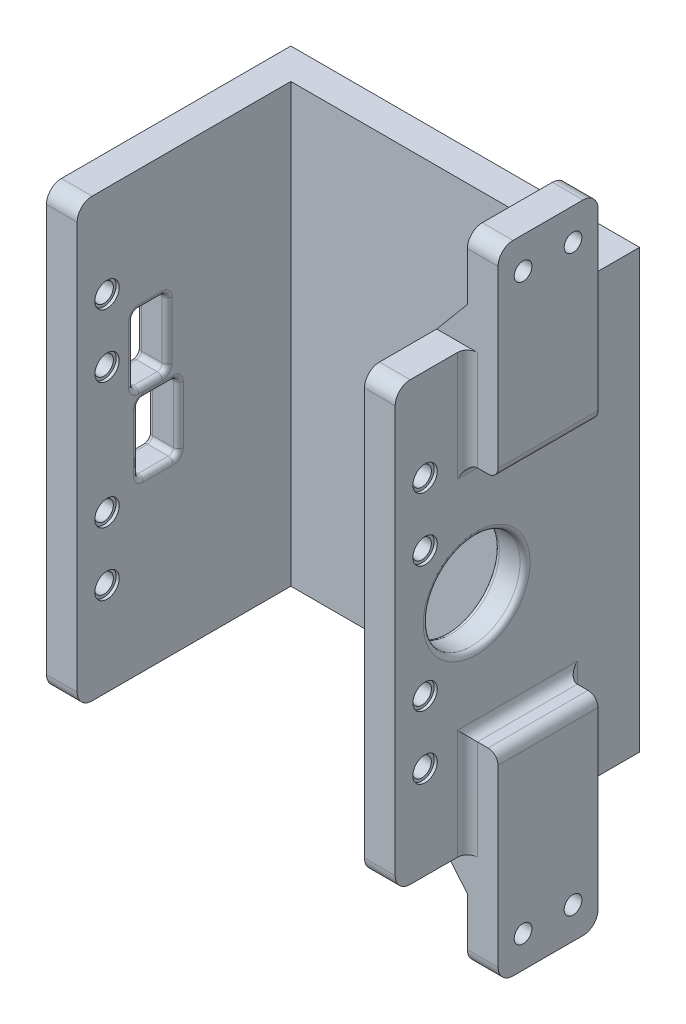
from build123d import *
from OCP.BRepFilletAPI import BRepFilletAPI_MakeChamfer

# Parameters (mm, degrees)
SKETCH1_W               = 55.1
SKETCH1_H               = 111.1
BOSS_EXTRUDE1_DEPTH     = 7.8
SKETCH2_W               = 7.8
SKETCH2_H               = 111.1
BOSS_EXTRUDE2_DEPTH     = 73.025
SKETCH4_W               = 55.1
SKETCH4_H               = 111.1
BOSS_EXTRUDE3_DEPTH     = 7.8
SKETCH7_W               = 7.8
SKETCH7_H               = 111.1
BOSS_EXTRUDE4_DEPTH     = 7
SKETCH8_R               = 2.4
CUT_EXTRUDE4_DEPTH      = 12.7
SKETCH8_4_R             = 3.1
CUT_EXTRUDE5_DEPTH      = 0.8
MIRROR2_COPY_1_SKETCH_R = 3.1
MIRROR2_COPY_1_DEPTH    = 0.8
SKETCH10_R              = 12.3
CUT_EXTRUDE7_DEPTH      = 7.8
SKETCH11_W              = 8.54
SKETCH11_H              = 17.14
SKETCH11_W_2            = 10.175
CUT_EXTRUDE8_DEPTH      = 7.8
FILLET1_R               = 1.27
SKETCH12_W              = 7.8
SKETCH12_H              = 25.4
BOSS_EXTRUDE5_DEPTH     = 25.4
CHAMFER2_SIZE           = 7.8
CHAMFER2_SIZE_2         = 9.295678022
FILLET3_R               = 3.81
FILLET4_R               = 2.54
F_8_CLEARANCE_HOLE1_D   = 4.4958


with BuildPart() as part:
    # Sketch1 → Boss-Extrude1 (new body)
    with BuildSketch(Plane(origin=(0, 0, 0), x_dir=(0, 0, -1), z_dir=(1, 0, 0))):
        with Locations((27.55, 55.55)):
            Rectangle(SKETCH1_W, SKETCH1_H)
    extrude(amount=BOSS_EXTRUDE1_DEPTH)

    # Sketch2 → Boss-Extrude2 (add)
    with BuildSketch(Plane.ZY):
        with Locations((-51.2, 55.55)):
            Rectangle(SKETCH2_W, SKETCH2_H)
    extrude(amount=BOSS_EXTRUDE2_DEPTH)

    # Sketch4 → Boss-Extrude3 (add)
    with BuildSketch(Plane.ZY.offset(73.025)):
        with Locations((-27.55, 55.55)):
            Rectangle(SKETCH4_W, SKETCH4_H)
    extrude(amount=BOSS_EXTRUDE3_DEPTH)

    # Sketch7 → Boss-Extrude4 (add)
    with BuildSketch(Plane.XY):
        with Locations((3.9, 55.55)):
            Rectangle(SKETCH7_W, SKETCH7_H)
    boss_extrude4 = extrude(amount=BOSS_EXTRUDE4_DEPTH)

    # Sketch8 → Cut-Extrude4 (cut)
    with BuildSketch(Plane(origin=(7.8, 0, 0), x_dir=(0, 0, -1), z_dir=(1, 0, 0))):
        with Locations((0.6, 23.6)):
            Circle(SKETCH8_R)
        with Locations((0.6, 39.6)):
            Circle(SKETCH8_R)
        with Locations((0.6, 87.6)):
            Circle(SKETCH8_R)
        with Locations((0.6, 71.6)):
            Circle(SKETCH8_R)
    cut_extrude4 = extrude(amount=-CUT_EXTRUDE4_DEPTH, mode=Mode.SUBTRACT)

    # Sketch8<4> → Cut-Extrude5 (cut)
    with BuildSketch(Plane(origin=(7.8, 0, 0), x_dir=(0, 0, -1), z_dir=(1, 0, 0))):
        with Locations((0.6, 23.6)):
            Circle(SKETCH8_4_R)
        with Locations((0.6, 39.6)):
            Circle(SKETCH8_4_R)
        with Locations((0.6, 87.6)):
            Circle(SKETCH8_4_R)
        with Locations((0.6, 71.6)):
            Circle(SKETCH8_4_R)
    cut_extrude5 = extrude(amount=-CUT_EXTRUDE5_DEPTH, mode=Mode.SUBTRACT)

    # Mirror1: Cut-Extrude5 across plane
    add(cut_extrude5.mirror(Plane(origin=(3.9, 0, 0), x_dir=(0, 0, 1), z_dir=(1, 0, 0))), mode=Mode.SUBTRACT)

    # Mirror2: Boss-Extrude4, Cut-Extrude4, Cut-Extrude5 across plane
    add(boss_extrude4.mirror(Plane.ZY.offset(36.5125)))
    add(cut_extrude4.mirror(Plane.ZY.offset(36.5125)), mode=Mode.SUBTRACT)
    add(cut_extrude5.mirror(Plane.ZY.offset(36.5125)), mode=Mode.SUBTRACT)

    # Mirror2 copy 1 sketch → Mirror2 copy 1 (cut)
    with BuildSketch(Plane(origin=(-73.025, 0, 0), x_dir=(0, 0, -1), z_dir=(1, 0, 0))):
        with Locations((0.6, 23.6)):
            Circle(MIRROR2_COPY_1_SKETCH_R)
        with Locations((0.6, 39.6)):
            Circle(MIRROR2_COPY_1_SKETCH_R)
        with Locations((0.6, 87.6)):
            Circle(MIRROR2_COPY_1_SKETCH_R)
        with Locations((0.6, 71.6)):
            Circle(MIRROR2_COPY_1_SKETCH_R)
    extrude(amount=-MIRROR2_COPY_1_DEPTH, mode=Mode.SUBTRACT)

    # Sketch10 → Cut-Extrude7 (cut)
    with BuildSketch(Plane(origin=(7.8, 0, 0), x_dir=(0, 0, -1), z_dir=(1, 0, 0))):
        with Locations((13.7, 55.7)):
            Circle(SKETCH10_R)
    extrude(amount=-CUT_EXTRUDE7_DEPTH, mode=Mode.SUBTRACT)

    # Sketch11 → Cut-Extrude8 (cut)
    with BuildSketch(Plane.ZY.offset(80.825)):
        with Locations((-11.6, 71.500000124)):
            Rectangle(SKETCH11_W, SKETCH11_H)
        with Locations((-13.6175, 51.5)):
            Rectangle(SKETCH11_W_2, SKETCH11_H)
    extrude(amount=-CUT_EXTRUDE8_DEPTH, mode=Mode.SUBTRACT)

    # Fillet1
    fillet1_edges = [part.edges().sort_by_distance(p)[0] for p in [
        (7.8, 55.7, -1.4),
        (0, 55.7, -1.4),
        (-73.025, 80.070000124, -11.6),
        (-73.025, 71.500000124, -7.33),
        (-80.825, 71.500000124, -15.87),
        (-80.825, 62.930000124, -11.6),
        (-73.025, 62.930000124, -11.6),
        (-76.925, 62.930000124, -7.33),
        (-76.925, 80.070000124, -7.33),
        (-80.825, 71.500000124, -7.33),
        (-76.925, 80.070000124, -15.87),
        (-80.825, 80.070000124, -11.6),
        (-73.025, 71.500000124, -15.87),
        (-76.925, 62.930000124, -15.87),
        (-73.025, 60.07, -13.6175),
        (-73.025, 51.5, -8.53),
        (-80.825, 51.5, -18.705),
        (-80.825, 42.93, -13.6175),
        (-73.025, 51.5, -18.705),
        (-76.925, 42.93, -18.705),
        (-73.025, 42.93, -13.6175),
        (-76.925, 42.93, -8.53),
        (-76.925, 60.07, -8.53),
        (-80.825, 51.5, -8.53),
        (-76.925, 60.07, -18.705),
        (-80.825, 60.07, -13.6175),
    ]]
    fillet(fillet1_edges, radius=FILLET1_R)

    # Sketch12 → Boss-Extrude5 (add, symmetric)
    with BuildSketch(Plane(origin=(0, 111.1, 0), x_dir=(1, 0, 0), z_dir=(0, 1, 0))):
        with Locations((11.7, 24.05)):
            Rectangle(SKETCH12_W, SKETCH12_H)
    boss_extrude5 = extrude(amount=BOSS_EXTRUDE5_DEPTH, both=True)

    # Mirror6: Boss-Extrude5 across plane
    add(boss_extrude5.mirror(Plane.ZX.offset(55.55)))

    # Chamfer2
    chamfer2_edges_1 = [part.edges().sort_by_distance(p)[0] for p in [
        (7.8, 111.1, -24.05),
    ]]
    chamfer2_side_1 = [part.faces().sort_by_distance(p)[0] for p in [
        (7.644, 111.1, -24.05),
    ]]
    chamfer2_edges_2 = [part.edges().sort_by_distance(p)[0] for p in [
        (7.8, 0, -24.05),
    ]]
    chamfer2_side_2 = [part.faces().sort_by_distance(p)[0] for p in [
        (7.644, 0, -24.05),
    ]]
    chamfer2 = BRepFilletAPI_MakeChamfer(part.part.solid().wrapped)
    for e in chamfer2_edges_1:
        chamfer2.Add(CHAMFER2_SIZE - 0.0001, CHAMFER2_SIZE_2 - 0.0001, e.wrapped, chamfer2_side_1[0].wrapped)
    for e in chamfer2_edges_2:
        chamfer2.Add(CHAMFER2_SIZE - 0.0001, CHAMFER2_SIZE_2 - 0.0001, e.wrapped, chamfer2_side_2[0].wrapped)
    add(Compound.cast(chamfer2.Shape()), mode=Mode.REPLACE)  # a hair under: the kernel refuses the full size

    # Fillet3
    fillet3_edges = [part.edges().sort_by_distance(p)[0] for p in [
        (-76.925, 111.1, 7),
        (-76.925, 0, 7),
        (11.7, 136.5, -11.35),
        (11.7, 136.5, -36.75),
        (11.7, -25.4, -36.75),
        (11.7, -25.4, -11.35),
        (3.9, 0, 7),
        (3.9, 111.1, 7),
    ]]
    fillet(fillet3_edges, radius=FILLET3_R)

    # Fillet4
    fillet4_edges = [part.edges().sort_by_distance(p)[0] for p in [
        (7.8, 98.4, -36.75),
        (7.8, 98.4, -11.35),
        (7.8, 85.7, -24.05),
        (15.6, 85.7, -24.05),
        (7.8, 12.7, -11.35),
        (7.8, 12.7, -36.75),
        (7.8, 25.4, -24.05),
        (15.6, 25.4, -24.05),
    ]]
    fillet(fillet4_edges, radius=FILLET4_R)

    # #8 Clearance Hole1 (through all)
    with Locations(Plane.ZY.offset(-7.8)):
        with Locations((-30.4, 128.447839011), (-17.7, 128.447839011)):
            f_8_clearance_hole1 = Hole(F_8_CLEARANCE_HOLE1_D / 2)

    # Mirror7: #8 Clearance Hole1 across plane
    add(f_8_clearance_hole1.mirror(Plane.ZX.offset(55.55)), mode=Mode.SUBTRACT)


solid = part.part
